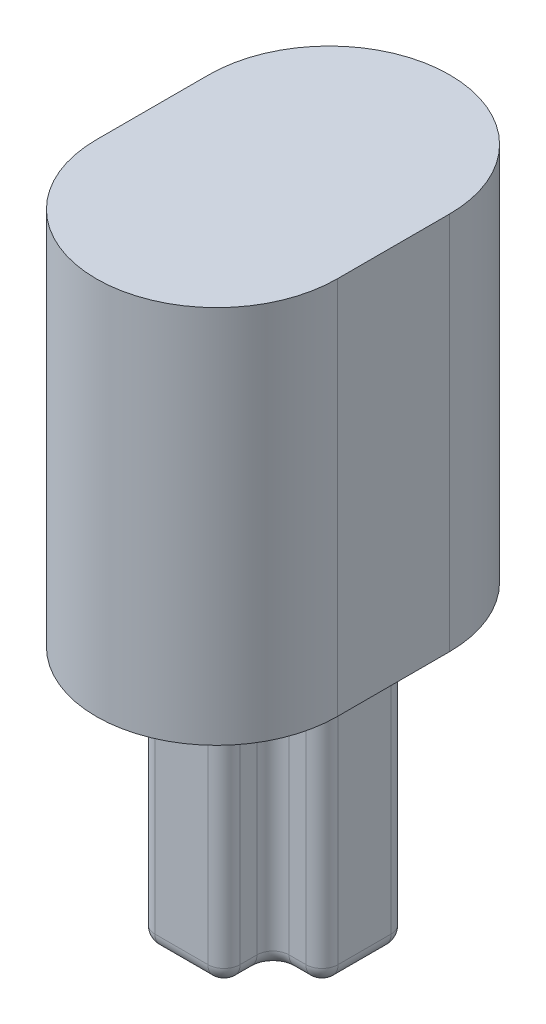
from build123d import *

# Parameters (mm, degrees)
BOSS_EXTRUDE1_DEPTH = 8.1
BOSS_EXTRUDE2_DEPTH = 11.8
FILLET1_R           = 0.5
FILLET2_R           = 0.5
FILLET4_R           = 0.5


with BuildPart() as part:
    # Sketch8 → Boss-Extrude1 (new body)
    with BuildSketch(Plane(origin=(-2.232753674, 0, 0.665681661), x_dir=(-1, 0, 0), z_dir=(0, -1, 0))):
        Polygon((-24.744344877, -18.877779499), (-23.219344877, -18.877779499), (-23.219344877, -21.527779499), (-24.744344877, -21.527779499), (-24.744344877, -23.052779499), (-27.394344877, -23.052779499), (-27.394344877, -21.527779499), (-28.919344877, -21.527779499), (-28.919344877, -18.877779499), (-27.394344877, -18.877779499), (-27.394344877, -17.352779499), (-24.744344877, -17.352779499), align=None)
        Polygon((-26.694344877, -20.827779499), (-26.694344877, -22.352779499), (-25.444344877, -22.352779499), (-25.444344877, -20.827779499), (-23.919344877, -20.827779499), (-23.919344877, -19.577779499), (-25.444344877, -19.577779499), (-25.444344877, -18.052779499), (-26.694344877, -18.052779499), (-26.694344877, -19.577779499), (-28.219344877, -19.577779499), (-28.219344877, -20.827779499), align=None, mode=Mode.SUBTRACT)
    extrude(amount=BOSS_EXTRUDE1_DEPTH)

    # Sketch9 → Boss-Extrude2 (add)
    with BuildSketch(Plane(origin=(0, 0, 0), x_dir=(-1, 0, 0), z_dir=(0, 1, 0))):
        with BuildLine():
            Line((-20.086591203, 22.61846116), (-20.086591203, 19.11846116))
            ThreePointArc((-20.086591203, 19.11846116), (-23.836591203, 15.36846116), (-27.586591203, 19.11846116))
            Line((-27.586591203, 19.11846116), (-27.586591203, 22.61846116))
            ThreePointArc((-27.586591203, 22.61846116), (-23.836591203, 26.36846116), (-20.086591203, 22.61846116))
        make_face()
    extrude(amount=BOSS_EXTRUDE2_DEPTH)

    # Fillet1
    fillet1_edges = [part.edges().sort_by_distance(p)[0] for p in [
        (22.511591203, -4.05, 19.54346116),
        (20.986591203, -4.05, 19.54346116),
        (20.986591203, -4.05, 22.19346116),
        (22.511591203, -4.05, 22.19346116),
        (22.511591203, -4.05, 23.71846116),
        (25.161591203, -4.05, 23.71846116),
        (25.161591203, -4.05, 22.19346116),
        (26.686591203, -4.05, 22.19346116),
        (26.686591203, -4.05, 19.54346116),
        (25.161591203, -4.05, 19.54346116),
        (22.511591203, -4.05, 18.01846116),
        (25.161591203, -4.05, 18.01846116),
    ]]
    fillet(fillet1_edges, radius=FILLET1_R)

    # Fillet2
    fillet2_edges = [part.edges().sort_by_distance(p)[0] for p in [
        (22.511591203, 0, 18.78096116),
        (22.658037813, 0, 18.164907769),
        (23.836591203, 0, 18.01846116),
        (25.015144594, 0, 18.164907769),
        (25.161591203, 0, 18.78096116),
        (25.308037813, 0, 19.39701455),
        (25.924091203, 0, 19.54346116),
        (26.540144594, 0, 19.689907769),
        (26.686591203, 0, 20.86846116),
        (26.540144594, 0, 22.04701455),
        (25.924091203, 0, 22.19346116),
        (25.308037813, 0, 22.339907769),
        (25.161591203, 0, 22.95596116),
        (25.015144594, 0, 23.57201455),
        (23.836591203, 0, 23.71846116),
        (22.658037813, 0, 23.57201455),
        (22.511591203, 0, 22.95596116),
        (22.365144594, 0, 22.339907769),
        (21.749091203, 0, 22.19346116),
        (21.133037813, 0, 22.04701455),
        (20.986591203, 0, 20.86846116),
        (21.133037813, 0, 19.689907769),
        (21.749091203, 0, 19.54346116),
        (22.365144594, 0, 19.39701455),
    ]]
    fillet(fillet2_edges, radius=FILLET2_R)

    # Fillet4
    fillet4_edges = [part.edges().sort_by_distance(p)[0] for p in [
        (25.015144594, -8.1, 23.57201455),
        (25.161591203, -8.1, 22.95596116),
        (25.308037813, -8.1, 22.339907769),
        (25.924091203, -8.1, 22.19346116),
        (26.540144594, -8.1, 22.04701455),
        (26.686591203, -8.1, 20.86846116),
        (26.540144594, -8.1, 19.689907769),
        (25.924091203, -8.1, 19.54346116),
        (25.308037813, -8.1, 19.39701455),
        (25.161591203, -8.1, 18.78096116),
        (25.015144594, -8.1, 18.164907769),
        (23.836591203, -8.1, 18.01846116),
        (22.658037813, -8.1, 18.164907769),
        (22.511591203, -8.1, 18.78096116),
        (22.365144594, -8.1, 19.39701455),
        (21.749091203, -8.1, 19.54346116),
        (21.133037813, -8.1, 19.689907769),
        (20.986591203, -8.1, 20.86846116),
        (21.133037813, -8.1, 22.04701455),
        (21.749091203, -8.1, 22.19346116),
        (22.365144594, -8.1, 22.339907769),
        (22.511591203, -8.1, 22.95596116),
        (22.658037813, -8.1, 23.57201455),
        (23.836591203, -8.1, 23.71846116),
    ]]
    fillet(fillet4_edges, radius=FILLET4_R)


solid = part.part
